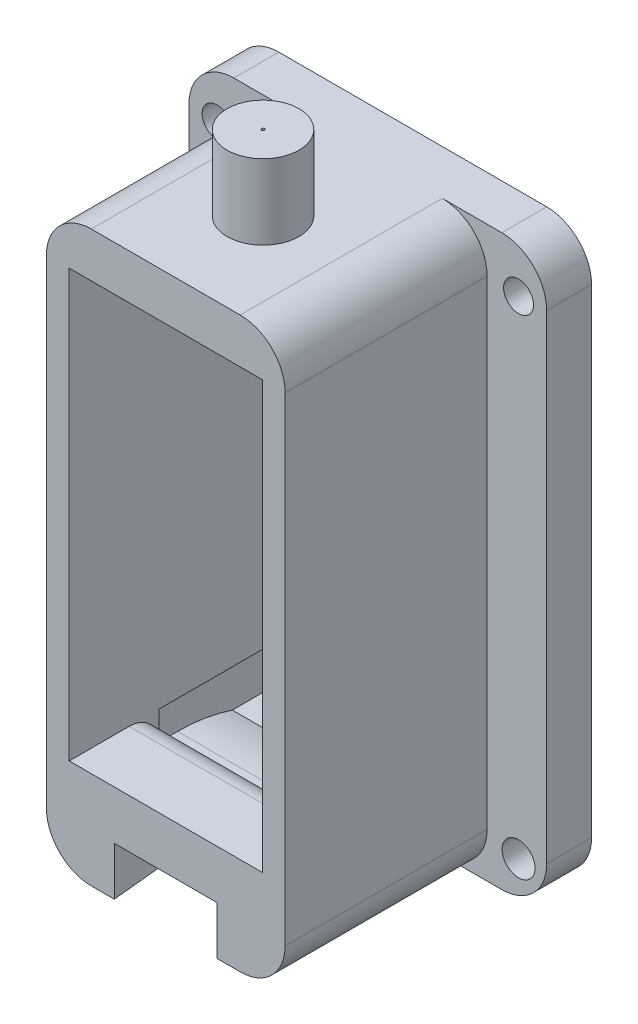
from build123d import *

# Parameters (mm, degrees)
SKETCH_1_W                = 32.6
SKETCH_1_H                = 34.6
SKETCH_1_R                = 1.25
SKETCH_1_W_2              = 24.6
SKETCH_1_H_2              = 24.2
EXTRUDE_1_DEPTH           = 13
SKETCH_3_W                = 6.5
SKETCH_3_H                = 6.519005167
CUT_EXTRUDE_1_DEPTH       = 19
SKETCH_4_W                = 6.5
SKETCH_4_H                = 6.467668889
CUT_EXTRUDE_2_DEPTH       = 23
EXTRUDE_2_DEPTH           = 50
SKETCH_1_2_W              = 22.27659965
SKETCH_1_2_H              = 4.598586669
SKETCH_1_2_W_2            = 22.283050596
SKETCH_1_2_H_2            = 4.977540741
CUT_EXTRUDE_5_DEPTH       = 34
FILLET_1_R                = 2
FILLET_2_R                = 2
SKETCH_9_W                = 54.594998093
SKETCH_9_H                = 18.111982385
SKETCH_9_W_2              = 52.534809486
SKETCH_9_H_2              = 12.989301534
CUT_EXTRUDE_6_DEPTH       = 41
FILLET_6_R                = 22
EXTRUDE_4_DEPTH           = 13
SKETCH_13_W               = 5.518907879
SKETCH_13_H               = 8.361822047
CUT_EXTRUDE_8_DEPTH       = 8.5
SKETCH_14_W               = 6.038657432
SKETCH_14_H               = 7.741248121
CUT_EXTRUDE_9_DEPTH       = 8.5
SKETCH_23_OUTSIDE_W       = 35.102
SKETCH_23_OUTSIDE_H       = 56.702
SKETCH_23_OUTSIDE_W_2     = 1.5
SKETCH_23_OUTSIDE_H_2     = 34.6
CUT_EXTRUDE_10_DEPTH      = 104
SKETCH_24_W               = 10.341780897
SKETCH_24_H               = 5.2
SKETCH_24_R               = 1.25
EXTRUDE_5_DEPTH           = 1.5
SKETCH_25_R               = 1.25
CUT_EXTRUDE_11_DEPTH      = 104
SKETCH_26_OUTSIDE_W       = 115.402
SKETCH_26_OUTSIDE_H       = 56.536
SKETCH_26_OUTSIDE_W_2     = 17.268409177
SKETCH_26_OUTSIDE_H_2     = 34.6
CUT_EXTRUDE_12_DEPTH      = 10
SKETCH_27_W               = 2.368409177
SKETCH_27_H               = 25.781356428
EXTRUDE_6_DEPTH           = 1.5
SKETCH_28_R               = 1.25
CUT_EXTRUDE_13_DEPTH      = 10
CUT_EXTRUDE_START         = -1.5
CUT_EXTRUDE_14_OUTLINE_W  = 0.368409177
CUT_EXTRUDE_14_OUTLINE_H  = 34.6
CUT_EXTRUDE_14_DEPTH      = 1.5
SKETCH_30_R               = 1.1
SKETCH_30_R_2             = 1
SKETCH_30_W               = 15.411127821
SKETCH_30_H               = 34.6
EXTRUDE_7_DEPTH           = 1.5
SKETCH_33_W               = 23.9
SKETCH_33_H               = 38.011921137
SKETCH_33_R               = 1.25
SKETCH_33_R_2             = 1
EXTRUDE_8_DEPTH           = 15
SKETCH_34_OUTSIDE_W       = 35.468
SKETCH_34_OUTSIDE_H       = 49.58
SKETCH_34_OUTSIDE_W_2     = 15.945908464
SKETCH_34_OUTSIDE_H_2     = 43.183358486
CUT_EXTRUDE_15_DEPTH      = 13.5
SKETCH_35_W               = 12.9
SKETCH_35_H               = 31.784162084
CUT_EXTRUDE_16_DEPTH      = 11
SKETCH_37_R               = 2.4
EXTRUDE_9_DEPTH           = 5
SKETCH_39_W               = 13.171271292
SKETCH_39_H               = 33.849019387
CUT_EXTRUDE_17_DEPTH      = 3
FILLET_7_R                = 3
CUT_EXTRUDE_18_DEPTH      = 53.759852886
CUT_EXTRUDE_18_DEPTH_BACK = 53.759852886
SKETCH_40_R               = 0.1
SKETCH_42_W               = 13.648654979
SKETCH_42_H               = 4.665334349
EXTRUDE_10_DEPTH          = 11
CUT_EXTRUDE_19_DEPTH      = 4.493948053
SKETCH_43_R               = 3.607554058
CUT_EXTRUDE_20_DEPTH      = 1
SKETCH_44_W               = 12.990377478
SKETCH_44_H               = 2.596310078
CUT_EXTRUDE_21_DEPTH      = 7.5
SKETCH_46_W               = 13.018615597
SKETCH_46_H               = 10.987054625
EXTRUDE_11_DEPTH          = 1.259502583
SKETCH_48_W               = 7.320827495
SKETCH_48_H               = 3.139430645
EXTRUDE_12_DEPTH          = 1
FILLET_9_R                = 11.5
FILLET_11_R               = 2
FILLET_12_R               = 3
SKETCH_49_R               = 1.1
SKETCH_49_R_2             = 1
CUT_EXTRUDE_22_DEPTH      = 42.193941463


# Read off the part's stored shape, not the designer's step: 切除-拉伸14
with BuildPart() as part:
    # Sketch 1 → 凸台-拉伸1 (new body)
    with BuildSketch(Plane.XY):
        with Locations((-9.850980392, 1.274712581)):
            Rectangle(SKETCH_1_W, SKETCH_1_H)
        with Locations(Location((-15.700980392, 15.424712581, 0), (0, 0, 180))):
            Circle(SKETCH_1_R, mode=Mode.SUBTRACT)
        with Locations(Location((-3.600980392, 15.424712581, 0), (0, 0, 180))):
            Circle(SKETCH_1_R, mode=Mode.SUBTRACT)
        with Locations(Location((-15.700980392, -12.875287419, 0), (0, 0, 180))):
            Circle(SKETCH_1_R, mode=Mode.SUBTRACT)
        with Locations(Location((-3.600980392, -12.875287419, 0), (0, 0, 180))):
            Circle(SKETCH_1_R, mode=Mode.SUBTRACT)
        with Locations((-9.850980392, 1.274712581)):
            Rectangle(SKETCH_1_W_2, SKETCH_1_H_2, mode=Mode.SUBTRACT)
    extrude(amount=EXTRUDE_1_DEPTH)

    # 草图3 → 切除-拉伸1 (cut)
    with BuildSketch(Plane(origin=(0, 0, 0), x_dir=(-1, 0, 0), z_dir=(0, 0, -1))):
        with Locations((15.700980392, -10.82528742)):
            Rectangle(SKETCH_3_W, SKETCH_3_H)
    extrude(amount=-CUT_EXTRUDE_1_DEPTH, mode=Mode.SUBTRACT)

    # 草图4 → 切除-拉伸2 (cut)
    with BuildSketch(Plane.XY.offset(13)):
        with Locations((-3.600980392, -10.82528742)):
            Rectangle(SKETCH_4_W, SKETCH_4_H)
    extrude(amount=-CUT_EXTRUDE_2_DEPTH, mode=Mode.SUBTRACT)

    # 草图5 → 凸台-拉伸2 (add)
    with BuildSketch(Plane(origin=(6.449019608, 0, 0), x_dir=(0, 0, -1), z_dir=(1, 0, 0))):
        Polygon((-13, 18.574712581), (-13, 10.055461473), (-13, -16.025287419), (0, -16.025287419), (0, -15.027567927), (0, 16.282461831), (0, 18.574712581), align=None)
    extrude(amount=EXTRUDE_2_DEPTH)

    # Sketch 1 2 → 切除-拉伸5 (cut)
    with BuildSketch(Plane.XY.offset(13)):
        with Locations((24.037173058, -7.263594431)):
            Rectangle(SKETCH_1_2_W, SKETCH_1_2_H)
        with Locations((24.078382453, 0.81654228)):
            Rectangle(SKETCH_1_2_W_2, SKETCH_1_2_H_2)
    extrude(amount=-CUT_EXTRUDE_5_DEPTH, mode=Mode.SUBTRACT)

    # 圆角1
    fillet_1_edges = [part.edges().sort_by_distance(p)[0] for p in [
        (12.936857155, -1.672228091, 6.5),
        (12.936857155, 3.30531265, 6.5),
        (35.219907751, 3.30531265, 6.5),
        (35.219907751, -1.672228091, 6.5),
        (12.898873233, -9.562887765, 6.5),
        (12.898873233, -4.964301096, 6.5),
        (35.175472883, -4.964301096, 6.5),
        (35.175472883, -9.562887765, 6.5),
    ]]
    fillet(fillet_1_edges, radius=FILLET_1_R)

    # 圆角2
    fillet_2_edges = [part.edges().sort_by_distance(p)[0] for p in [
        (-26.150980392, -16.025287419, 6.5),
        (-26.150980392, 18.574712581, 6.5),
    ]]
    fillet(fillet_2_edges, radius=FILLET_2_R)

    # 草图9 → 切除-拉伸6 (cut)
    with BuildSketch(Plane(origin=(0, 0, 0), x_dir=(-1, 0, 0), z_dir=(0, 0, -1))):
        with Locations((-36.934177516, 16.051357777)):
            Rectangle(SKETCH_9_W, SKETCH_9_H)
        with Locations((-36.653242706, -19.247200889)):
            Rectangle(SKETCH_9_W_2, SKETCH_9_H_2)
    extrude(amount=-CUT_EXTRUDE_6_DEPTH, mode=Mode.SUBTRACT)

    # 圆角6
    # the kernel refuses this fillet: 22 mm, written as the material it adds along each edge
    with BuildSketch(Plane(origin=(9.636678469, 6.995366584, 0), x_dir=(0, 1, 0), z_dir=(0, 0, 1))) as fillet_6_piece_1:
        with BuildLine():
            CenterArc((22, -19.375499223), FILLET_6_R, 118.272534833, 61.727465167)
            Line((0, -19.375499223), (-0.44, -19.375499223))
            Line((-0.44, -19.375499223), (-0.44, 0))
            Line((-0.44, 0), (0, 0.44))
            ThreePointArc((0, 0.44), (5.789672998, 0.44), (11.370932916, 0.387509984))
            Line((11.370932916, 0.387509984), (11.579345996, 0))
        make_face()
    extrude(amount=13)
    with BuildSketch(Plane(origin=(10.385837963, -12.752550122, 0), x_dir=(1, 0, 0), z_dir=(0, 0, 1))) as fillet_6_piece_2:
        with BuildLine():
            CenterArc((11.54511289, -22), FILLET_6_R, 90, 31.653290012)
            Line((0, -3.272737297), (-0.230902258, -2.898192043))
            ThreePointArc((-0.230902258, -2.898192043), (-0.44, -1.636368649), (-0.44, 0))
            Line((-0.44, 0), (0, 0.44))
            Line((0, 0.44), (11.54511289, 0.44))
            Line((11.54511289, 0.44), (11.54511289, 0))
        make_face()
    extrude(amount=13)

    # 草图12 → 凸台-拉伸4 (add)
    with BuildSketch(Plane(origin=(0, 0, 0), x_dir=(-1, 0, 0), z_dir=(0, 0, -1))):
        with BuildLine():
            Line((24.150980392, 18.574712581), (24.496655084, -15.99518818))
            ThreePointArc((24.496655084, -15.99518818), (37.015647173, 1.416671567), (24.150980392, 18.574712581))
        make_face()
        with BuildLine():
            Line((26.822698684, 1.289948959), (26.822698684, -8.431688638))
            ThreePointArc((26.822698684, -8.431688638), (32.027920461, 1.289948959), (26.822698684, 11.011586556))
            Line((26.822698684, 11.011586556), (26.822698684, 1.289948959))
        make_face(mode=Mode.SUBTRACT)
    extrude(amount=-EXTRUDE_4_DEPTH)

    # 草图13 → 切除-拉伸8 (cut)
    with BuildSketch(Plane.XY.offset(13)):
        with Locations((-3.600980393, 15.424712581)):
            Rectangle(SKETCH_13_W, SKETCH_13_H)
    extrude(amount=-CUT_EXTRUDE_8_DEPTH, mode=Mode.SUBTRACT)

    # 草图14 → 切除-拉伸9 (cut)
    with BuildSketch(Plane(origin=(0, 0, 0), x_dir=(-1, 0, 0), z_dir=(0, 0, -1))):
        with Locations((15.700980392, 15.424712581)):
            Rectangle(SKETCH_14_W, SKETCH_14_H)
    extrude(amount=-CUT_EXTRUDE_9_DEPTH, mode=Mode.SUBTRACT)

    # 草图23 outside → 切除-拉伸10 (cut)
    with BuildSketch(Plane(origin=(56.449019608, 0, 0), x_dir=(0, 0, -1), z_dir=(1, 0, 0))):
        with Locations((-6.5, 1.275)):
            Rectangle(SKETCH_23_OUTSIDE_W, SKETCH_23_OUTSIDE_H)
        with Locations((-12.25, 1.274712581)):
            Rectangle(SKETCH_23_OUTSIDE_W_2, SKETCH_23_OUTSIDE_H_2, mode=Mode.SUBTRACT)
    extrude(amount=-CUT_EXTRUDE_10_DEPTH, mode=Mode.SUBTRACT)

    # 草图24 → 凸台-拉伸5 (add)
    with BuildSketch(Plane.XY.offset(13)):
        with Locations((-4.17557206, 15.974712581)):
            Rectangle(SKETCH_24_W, SKETCH_24_H)
        with Locations((-3.600980392, 15.429779286)):
            Circle(SKETCH_24_R, mode=Mode.SUBTRACT)
    extrude(amount=-EXTRUDE_5_DEPTH)

    # 草图25 → 切除-拉伸11 (cut)
    with BuildSketch(Plane.XY.offset(13)):
        with Locations((42.624971711, -3.793205976)):
            Circle(SKETCH_25_R)
        with Locations((-34.434765713, 1.289948959)):
            Circle(SKETCH_25_R)
        with Locations((-25.484048207, 14.316394652)):
            Circle(SKETCH_25_R)
        with Locations((-25.484048207, -12.050711449)):
            Circle(SKETCH_25_R)
    extrude(amount=-CUT_EXTRUDE_11_DEPTH, mode=Mode.SUBTRACT)

    # 草图26 outside → 切除-拉伸12 (cut)
    with BuildSketch(Plane.XY.offset(13)):
        with Locations((9.716, 1.275)):
            Rectangle(SKETCH_26_OUTSIDE_W, SKETCH_26_OUTSIDE_H)
        with Locations((-15.516775803, 1.274712581)):
            Rectangle(SKETCH_26_OUTSIDE_W_2, SKETCH_26_OUTSIDE_H_2, mode=Mode.SUBTRACT)
    extrude(amount=-CUT_EXTRUDE_12_DEPTH, mode=Mode.SUBTRACT)

    # 草图27 → 凸台-拉伸6 (add)
    with BuildSketch(Plane.XY.offset(13)):
        with Locations((-8.066775804, 0.484034367)):
            Rectangle(SKETCH_27_W, SKETCH_27_H)
    extrude(amount=-EXTRUDE_6_DEPTH)

    # 草图28 → 切除-拉伸13 (cut)
    with BuildSketch(Plane.XY.offset(13)):
        with Locations((-19.200980392, 15.384992379)):
            Circle(SKETCH_28_R)
        with Locations((-12.200980392, 15.384992379)):
            Circle(SKETCH_28_R)
    extrude(amount=-CUT_EXTRUDE_13_DEPTH, mode=Mode.SUBTRACT)

    # 切除-拉伸14 outline → 切除-拉伸14 (cut)
    with BuildSketch(Plane.XY.offset(13).offset(CUT_EXTRUDE_START)):
        with Locations((-7.066775804, 1.274712581)):
            Rectangle(CUT_EXTRUDE_14_OUTLINE_W, CUT_EXTRUDE_14_OUTLINE_H)
    extrude(amount=CUT_EXTRUDE_14_DEPTH, mode=Mode.SUBTRACT)

    # 草图30 → 凸台-拉伸7 (add)
    with BuildSketch(Plane.XY.offset(13)):
        Polygon((-27.650980392, 18.574712581), (-27.650980392, -16.025287419), (-27.650980392, -17.319235473), (-3.750980392, -17.319235473), (-3.750980392, -16.025287419), (-3.750980392, 18.574712581), (-3.750980392, 20.692685664), (-27.650980392, 20.692685664), align=None)
        with Locations((-25.773264037, -15.025287419)):
            Circle(SKETCH_30_R, mode=Mode.SUBTRACT)
        with Locations((-25.773264037, 17.574712581)):
            Circle(SKETCH_30_R_2, mode=Mode.SUBTRACT)
        with Locations((-5.628696747, 17.574712581)):
            Circle(SKETCH_30_R_2, mode=Mode.SUBTRACT)
        with Locations((-5.628696747, -15.025287419)):
            Circle(SKETCH_30_R, mode=Mode.SUBTRACT)
        with Locations((-15.213421192, 1.274712581)):
            Rectangle(SKETCH_30_W, SKETCH_30_H, mode=Mode.SUBTRACT)
    extrude(amount=-EXTRUDE_7_DEPTH)

    # 草图33 → 凸台-拉伸8 (add)
    with BuildSketch(Plane(origin=(0, 0, 11.5), x_dir=(-1, 0, 0), z_dir=(0, 0, -1))):
        with Locations((15.700980392, 1.686725095)):
            Rectangle(SKETCH_33_W, SKETCH_33_H)
        with Locations((15.700980392, 15.424712581)):
            Circle(SKETCH_33_R, mode=Mode.SUBTRACT)
        with Locations(Location((12.200980392, 15.384992379, 0), (0, 0, 180))):
            Circle(SKETCH_33_R, mode=Mode.SUBTRACT)
        with Locations(Location((19.200980392, 15.384992379, 0), (0, 0, 180))):
            Circle(SKETCH_33_R, mode=Mode.SUBTRACT)
        with Locations(Location((25.773264037, 17.574712581, 0), (0, 0, 180))):
            Circle(SKETCH_33_R_2, mode=Mode.SUBTRACT)
        with Locations(Location((5.628696747, 17.574712581, 0), (0, 0, 180))):
            Circle(SKETCH_33_R_2, mode=Mode.SUBTRACT)
        with BuildLine():
            Line((9.250980392, -10.825287419), (12.450980392, -10.825287419))
            Line((12.450980392, -10.825287419), (12.450980392, -14.084790003))
            Line((12.450980392, -14.084790003), (15.385380168, -14.084790003))
            ThreePointArc((15.385380168, -14.084790003), (15.700980392, -14.125287419), (16.016580616, -14.084790003))
            Line((16.016580616, -14.084790003), (18.950980392, -14.084790003))
            Line((18.950980392, -14.084790003), (18.950980392, -10.825287419))
            Line((18.950980392, -10.825287419), (22.150980392, -10.825287419))
            Line((22.150980392, -10.825287419), (22.150980392, 13.374712581))
            Line((22.150980392, 13.374712581), (9.250980392, 13.374712581))
            Line((9.250980392, 13.374712581), (9.250980392, -10.825287419))
        make_face(mode=Mode.SUBTRACT)
    extrude(amount=EXTRUDE_8_DEPTH)

    # 草图34 outside → 切除-拉伸15 (cut)
    with BuildSketch(Plane.XY.offset(13)):
        with Locations((-15.701, 1.687)):
            Rectangle(SKETCH_34_OUTSIDE_W, SKETCH_34_OUTSIDE_H)
        with Locations((-15.700980392, 2.766642636)):
            Rectangle(SKETCH_34_OUTSIDE_W_2, SKETCH_34_OUTSIDE_H_2, mode=Mode.SUBTRACT)
    extrude(amount=-CUT_EXTRUDE_15_DEPTH, mode=Mode.SUBTRACT)

    # 草图35 → 切除-拉伸16 (cut)
    with BuildSketch(Plane.XY.offset(13)):
        with Locations((-15.700980392, 1.798395824)):
            Rectangle(SKETCH_35_W, SKETCH_35_H)
    extrude(amount=-CUT_EXTRUDE_16_DEPTH, mode=Mode.SUBTRACT)

    # 草图37 → 凸台-拉伸9 (add)
    with BuildSketch(Plane(origin=(0, 20.692685664, 0), x_dir=(1, 0, 0), z_dir=(0, 1, 0))):
        with Locations(Location((-15.700980392, -6.5, 0), (0, 0, 270))):
            Circle(SKETCH_37_R)
    extrude(amount=EXTRUDE_9_DEPTH)

    # 草图39 → 切除-拉伸17 (cut)
    with BuildSketch(Plane(origin=(0, 0, -3.5), x_dir=(-1, 0, 0), z_dir=(0, 0, -1))):
        with Locations((15.655722224, 1.624936556)):
            Rectangle(SKETCH_39_W, SKETCH_39_H)
    extrude(amount=-CUT_EXTRUDE_17_DEPTH, mode=Mode.SUBTRACT)

    # 圆角7
    fillet_7_edges = [part.edges().sort_by_distance(p)[0] for p in [
        (-27.650980392, -17.319235473, -2),
        (-27.650980392, 20.692685664, -2),
        (-3.750980392, 20.692685664, -2),
        (-3.750980392, -17.319235473, -2),
    ]]
    fillet(fillet_7_edges, radius=FILLET_7_R)

    # 草图40 → 切除-拉伸18 (cut, two sides: drawn at the far end of the back side and taken through both)
    with BuildSketch(Plane(origin=(0, 25.692685664, 0), x_dir=(1, 0, 0), z_dir=(0, 1, 0)).offset(-CUT_EXTRUDE_18_DEPTH_BACK)):
        with Locations(Location((-15.700980392, -6.5, 0), (0, 0, 270))):
            Circle(SKETCH_40_R)
    extrude(amount=CUT_EXTRUDE_18_DEPTH + CUT_EXTRUDE_18_DEPTH_BACK, mode=Mode.SUBTRACT)

    # 草图42 → 凸台-拉伸10 (add)
    with BuildSketch(Plane.XY.offset(2)):
        with Locations((-15.66246504, -13.157954594)):
            Rectangle(SKETCH_42_W, SKETCH_42_H)
    extrude(amount=EXTRUDE_10_DEPTH)

    # 草图41 → 切除-拉伸19 (cut)
    with BuildSketch(Plane.XZ.offset(17.319235473)):
        with BuildLine():
            Line((-19.775980392, 6.5), (-18.406082759, 20.501521641))
            ThreePointArc((-18.406082759, 20.501521641), (-15.665794747, 23.749766381), (-13.011106202, 20.431197259))
            Line((-13.011106202, 20.431197259), (-11.625980392, 6.5))
            ThreePointArc((-11.625980392, 6.5), (-15.700980392, 2.425), (-19.775980392, 6.5))
        make_face()
    extrude(amount=-CUT_EXTRUDE_19_DEPTH, mode=Mode.SUBTRACT)

    # 草图43 → 切除-拉伸20 (cut)
    with BuildSketch(Plane.XZ.offset(12.825287419)):
        with Locations(Location((-15.700980392, 6.5, 0), (0, 0, 270))):
            Circle(SKETCH_43_R)
    extrude(amount=-CUT_EXTRUDE_20_DEPTH, mode=Mode.SUBTRACT)

    # 草图44 → 切除-拉伸21 (cut)
    with BuildSketch(Plane(origin=(0, 0, -0.5), x_dir=(-1, 0, 0), z_dir=(0, 0, -1))):
        with Locations((15.746169131, -12.123442458)):
            Rectangle(SKETCH_44_W, SKETCH_44_H)
    extrude(amount=-CUT_EXTRUDE_21_DEPTH, mode=Mode.SUBTRACT)

    # 草图46 → 凸台-拉伸11 (add)
    with BuildSketch(Plane.XZ.offset(12.825287419)):
        with Locations((-15.749811773, 7.506472688)):
            Rectangle(SKETCH_46_W, SKETCH_46_H)
    extrude(amount=EXTRUDE_11_DEPTH)

    # 草图48 → 凸台-拉伸12 (add)
    with BuildSketch(Plane.XZ.offset(11.825287419)):
        with Locations((-15.761363582, 8.5864607)):
            Rectangle(SKETCH_48_W, SKETCH_48_H)
    extrude(amount=EXTRUDE_12_DEPTH)

    # 圆角9
    # the kernel refuses this fillet: 11.5 mm, written as the material it takes off along each edge
    with BuildSketch(Plane(origin=(-22.24135787, -12.825287419, 2.012945375), x_dir=(0, -1.0, 1.3077435417698884e-12), z_dir=(1, 0, 0))) as fillet_9_piece_1:
        with BuildLine():
            CenterArc((11.5, -3.655071281), FILLET_9_R, 161.468118769, 18.531881231)
            Line((0, -3.655071281), (0, 0))
            Line((0, 0), (0.596310077, 0))
        make_face()
    extrude(amount=12.990377478, mode=Mode.SUBTRACT)

    # 圆角11
    # the kernel refuses this fillet: 2 mm, written as the material it takes off along each edge
    with BuildSketch(Plane(origin=(-9.250980392, -10.825287419, 7), x_dir=(0, 0, 1), z_dir=(-1, 0, 0))) as fillet_11_piece_1:
        with BuildLine():
            CenterArc((FILLET_11_R, -FILLET_11_R), FILLET_11_R, 90, 90)
            Line((0, -FILLET_11_R), (0, 0))
            Line((0, 0), (FILLET_11_R, 0))
        make_face()
    extrude(amount=12.9, mode=Mode.SUBTRACT)

    # 圆角12
    fillet_12_edges = [part.edges().sort_by_distance(p)[0] for p in [
        (-7.72802616, -17.319235473, 6.25),
        (-23.673934624, -17.319235473, 6.25),
        (-7.72802616, 20.692685664, 6.25),
        (-23.673934624, 20.692685664, 6.25),
    ]]
    fillet(fillet_12_edges, radius=FILLET_12_R)

    # 草图49 → 切除-拉伸22 (cut, through all)
    with BuildSketch(Plane(origin=(0, 0, -3.5), x_dir=(-1, 0, 0), z_dir=(0, 0, -1))):
        with Locations(Location((5.628696747, -14.974790003, 0), (0, 0, 90))):
            Circle(SKETCH_49_R)
        with Locations(Location((25.773264037, -14.974790003, 0), (0, 0, 90))):
            Circle(SKETCH_49_R_2)
    extrude(amount=-CUT_EXTRUDE_22_DEPTH, mode=Mode.SUBTRACT)


solid = part.part
